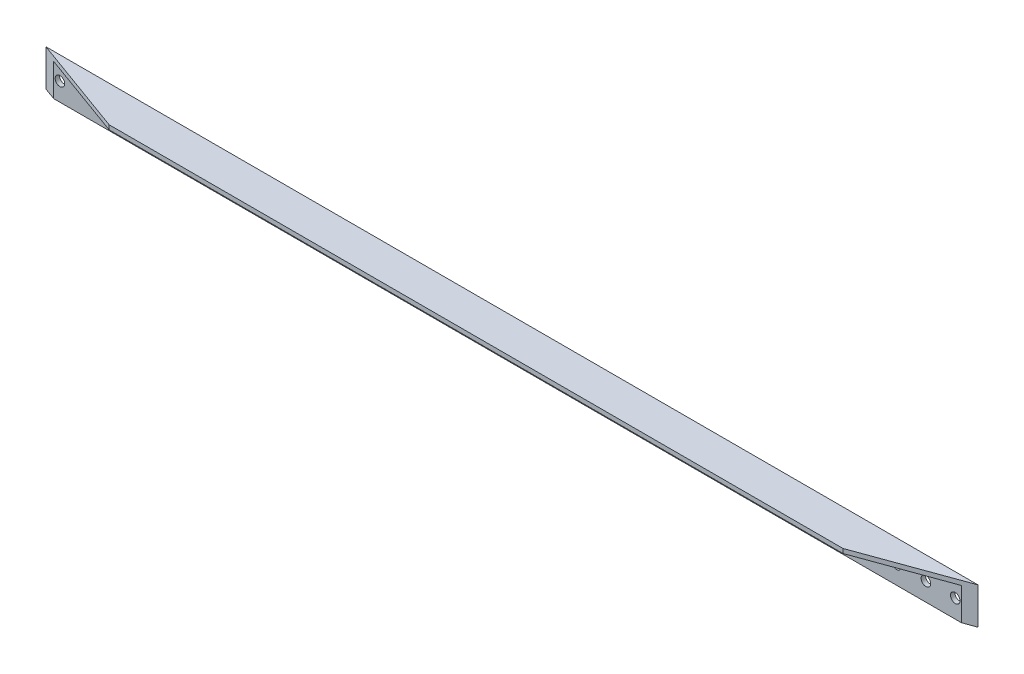
from build123d import *

# Parameters (mm, degrees)
SKETCH_1_W          = 2540
SKETCH_1_H          = 100
SKETCH_1_R          = 13
EXTRUDE_525_DEPTH   = 12
SKETCH_2_W          = 2540
SKETCH_2_H          = 12
EXTRUDE_1_DEPTH     = 86
CUT_EXTRUDE_1_DEPTH = 1278.694799238


with BuildPart() as part:
    # 草图1 → Extrude 525 (new body)
    with BuildSketch(Plane.XY):
        Rectangle(SKETCH_1_W, SKETCH_1_H)
        with Locations((1220, 0)):
            Circle(SKETCH_1_R, mode=Mode.SUBTRACT)
        with Locations((1140, 0)):
            Circle(SKETCH_1_R, mode=Mode.SUBTRACT)
        with Locations((1060, 0)):
            Circle(SKETCH_1_R, mode=Mode.SUBTRACT)
        with Locations((980, 0)):
            Circle(SKETCH_1_R, mode=Mode.SUBTRACT)
        with Locations((580, 0)):
            Circle(SKETCH_1_R, mode=Mode.SUBTRACT)
        with Locations((460, 0)):
            Circle(SKETCH_1_R, mode=Mode.SUBTRACT)
        with Locations((380, 0)):
            Circle(SKETCH_1_R, mode=Mode.SUBTRACT)
        with Locations((300, 0)):
            Circle(SKETCH_1_R, mode=Mode.SUBTRACT)
        with Locations((180, 0)):
            Circle(SKETCH_1_R, mode=Mode.SUBTRACT)
        with Locations((-180, 0)):
            Circle(SKETCH_1_R, mode=Mode.SUBTRACT)
        with Locations((-300, 0)):
            Circle(SKETCH_1_R, mode=Mode.SUBTRACT)
        with Locations((-380, 0)):
            Circle(SKETCH_1_R, mode=Mode.SUBTRACT)
        with Locations((-460, 0)):
            Circle(SKETCH_1_R, mode=Mode.SUBTRACT)
        with Locations((-580, 0)):
            Circle(SKETCH_1_R, mode=Mode.SUBTRACT)
        with Locations((-980, 0)):
            Circle(SKETCH_1_R, mode=Mode.SUBTRACT)
        with Locations((-1060, 0)):
            Circle(SKETCH_1_R, mode=Mode.SUBTRACT)
        with Locations((-1140, 0)):
            Circle(SKETCH_1_R, mode=Mode.SUBTRACT)
        with Locations((-1220, 0)):
            Circle(SKETCH_1_R, mode=Mode.SUBTRACT)
    extrude(amount=EXTRUDE_525_DEPTH)

    # 草图2 → 凸台-拉伸1 (add)
    with BuildSketch(Plane.XY.offset(12)):
        with Locations((0, 44)):
            Rectangle(SKETCH_2_W, SKETCH_2_H)
    extrude(amount=EXTRUDE_1_DEPTH)

    # 草图4 → 切除-拉伸1 (cut, through all)
    with BuildSketch(Plane(origin=(0, 50, 0), x_dir=(-1, 0, 0), z_dir=(0, 1, 0))):
        Polygon((-1270, 0), (-1270, 98), (-1000, 98), align=None)
        Polygon((1270, 0), (1000, 98), (1270, 98), align=None)
    extrude(amount=-CUT_EXTRUDE_1_DEPTH, mode=Mode.SUBTRACT)


solid = part.part
